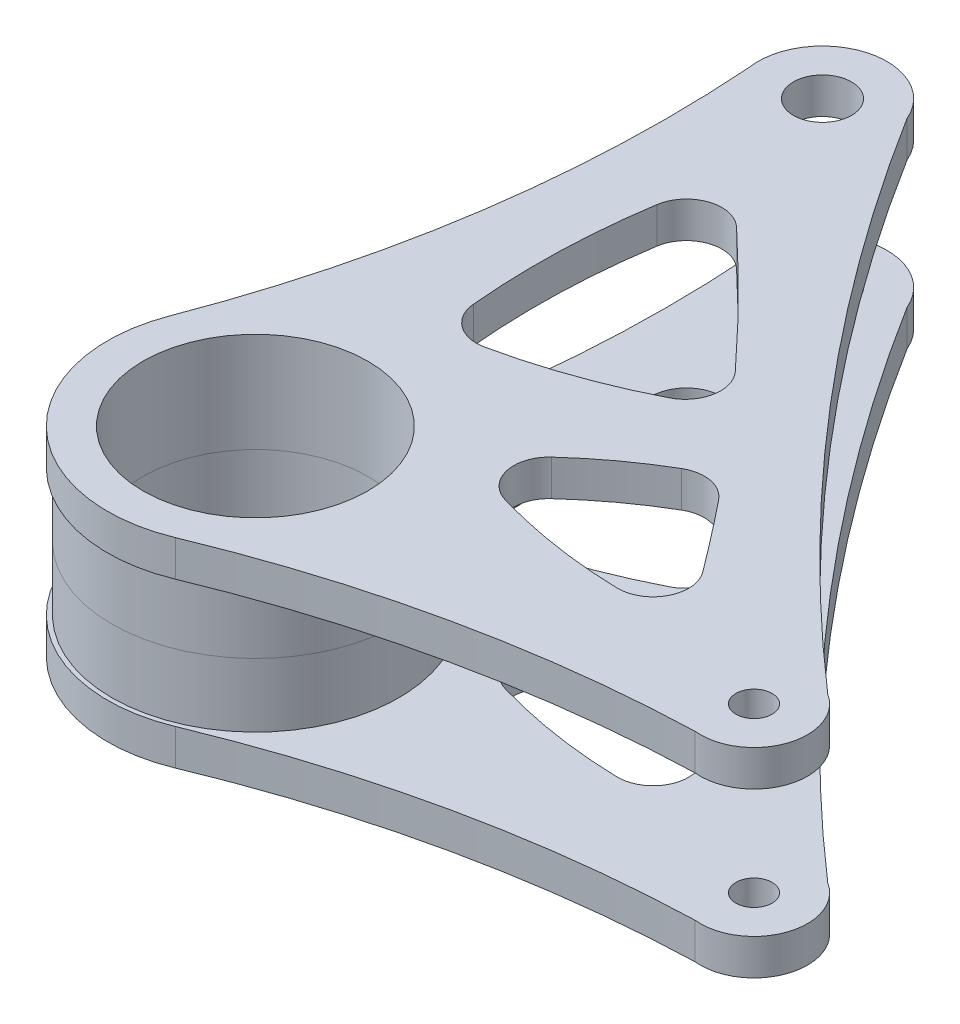
from build123d import *

# Parameters (mm, degrees)
SKETCH1_R           = 4.1
SKETCH1_R_2         = 15.8623
SKETCH1_R_3         = 2.55
BOSS_EXTRUDE1_DEPTH = 5.08
CUT_EXTRUDE1_DEPTH  = 118.648778806
FILLET1_R           = 5
SKETCH2_R           = 20.25
SKETCH2_R_2         = 15.8623
BOSS_EXTRUDE2_DEPTH = 9


with BuildPart() as part:
    # Sketch1 → Boss-Extrude1 (new body)
    with BuildSketch(Plane(origin=(0, 0, 0), x_dir=(1, 0, 0), z_dir=(0, 1, 0))):
        with BuildLine():
            ThreePointArc((6.92859567, 85.899539138), (-2.50515852, 88.74838161), (-9.001103193, 81.337961625))
            Line((-9.001103193, 81.337961625), (-20.635573093, 3.067357891))
            ThreePointArc((-20.635573093, 3.067357891), (-14.272359364, -15.21628468), (4.380807044, -20.397158894))
            Line((4.380807044, -20.397158894), (70.694507579, -6.154610316))
            ThreePointArc((70.694507579, -6.154610316), (76.259175154, -1.197614881), (74.857557701, 6.121729179))
            Line((74.857557701, 6.121729179), (6.92859567, 85.899539138))
        make_face()
        with Locations((0, 80)):
            Circle(SKETCH1_R, mode=Mode.SUBTRACT)
        Circle(SKETCH1_R_2, mode=Mode.SUBTRACT)
        with Locations((69.109107447, 1.227056598)):
            Circle(SKETCH1_R_3, mode=Mode.SUBTRACT)
    extrude(amount=BOSS_EXTRUDE1_DEPTH)

    # Sketch3 → Cut-Extrude1 (cut, through all)
    with BuildSketch(Plane(origin=(0, 5.08, 0), x_dir=(1, 0, 0), z_dir=(0, 1, 0))):
        with BuildLine():
            Line((74.857557701, 6.121729179), (6.92859567, 85.899539138))
            ThreePointArc((6.92859567, 85.899539138), (7.739936739, 84.785747516), (8.373803599, 83.562220274))
            ThreePointArc((8.373803599, 83.562220274), (37.931231119, 43.187947801), (73.125634893, 7.62002205))
            ThreePointArc((73.125634893, 7.62002205), (74.048734736, 6.936923693), (74.857557701, 6.121729179))
        make_face()
        with BuildLine():
            ThreePointArc((-8.993991676, 78.615040168), (-9.099968964, 79.9762334), (-9.001103193, 81.337961625))
            Line((-9.001103193, 81.337961625), (-20.635573093, 3.067357891))
            ThreePointArc((-20.635573093, 3.067357891), (-20.180913979, 5.28831469), (-19.487953881, 7.446825823))
            ThreePointArc((-19.487953881, 7.446825823), (-10.335992273, 42.455132152), (-8.993991676, 78.615040168))
        make_face()
        with BuildLine():
            Line((4.380807044, -20.397158894), (70.694507579, -6.154610316))
            ThreePointArc((70.694507579, -6.154610316), (69.513209705, -6.312121167), (68.321843219, -6.281785859))
            ThreePointArc((68.321843219, -6.281785859), (37.563201447, -10.050022698), (7.979797888, -19.275849837))
            ThreePointArc((7.979797888, -19.275849837), (6.205680629, -19.917958962), (4.380807044, -20.397158894))
        make_face()
        with BuildLine():
            ThreePointArc((19.080909655, 11.250219094), (36.663242325, 6.437712377), (54.889563885, 6.121729179))
            ThreePointArc((54.889563885, 6.121729179), (47.167735128, 16.666184237), (39.044241252, 26.904397902))
            ThreePointArc((39.044241252, 26.904397902), (28.24618646, 20.118426298), (19.080909655, 11.250219094))
        make_face()
        with BuildLine():
            ThreePointArc((3.041780229, 64.267991226), (0.175889719, 44.654135839), (1.12396198, 24.854696187))
            ThreePointArc((1.12396198, 24.854696187), (16.837219443, 28.774304989), (31.41631239, 35.825534821))
            ThreePointArc((31.41631239, 35.825534821), (17.651789409, 50.468496558), (3.041780229, 64.267991226))
        make_face()
    extrude(amount=-CUT_EXTRUDE1_DEPTH, mode=Mode.SUBTRACT)

    # Fillet1
    fillet1_edges = [part.edges().sort_by_distance(p)[0] for p in [
        (54.889563885, 2.54, -6.121729179),
        (19.080909655, 2.54, -11.250219094),
        (39.044241252, 2.54, -26.904397902),
        (31.41631239, 2.54, -35.825534821),
        (1.12396198, 2.54, -24.854696187),
        (3.041780229, 2.54, -64.267991226),
    ]]
    fillet(fillet1_edges, radius=FILLET1_R)

    # Sketch2 → Boss-Extrude2 (add)
    with BuildSketch(Plane(origin=(0, 5.08, 0), x_dir=(1, 0, 0), z_dir=(0, 1, 0))):
        Circle(SKETCH2_R)
        Circle(SKETCH2_R_2, mode=Mode.SUBTRACT)
    extrude(amount=BOSS_EXTRUDE2_DEPTH)


with BuildPart() as body_2:
    # Mirror1: mirrored copy
    add(part.part.mirror(Plane.ZX.offset(14.08)))


solid = Compound([part.part, body_2.part])
